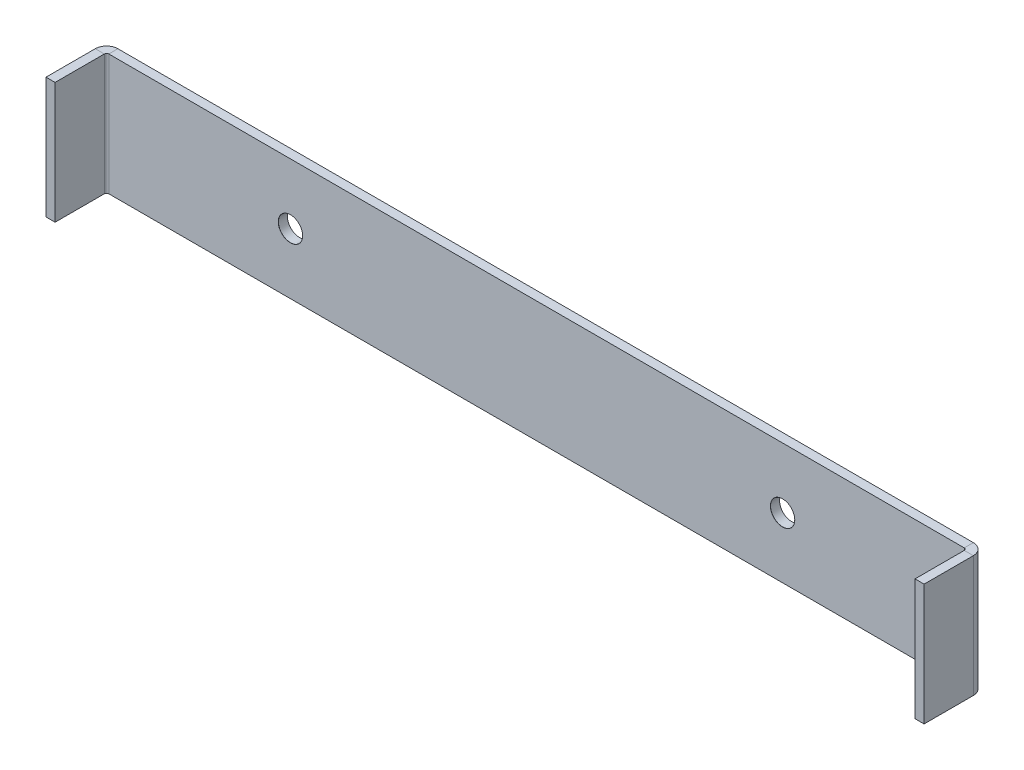
from build123d import *

# Parameters (mm, degrees)
SKETCH1_W                      = 290
SKETCH1_H                      = 40
BASE_FLANGE1_DEPTH             = 3
EDGE_FLANGE1_STRIP_W           = 13.4732
EDGE_FLANGE1_STRIP_H           = 3
EDGE_FLANGE1_STRIP_CUT_DEPTH   = 40
EDGE_FLANGE1_DEPTH             = 40
EDGE_FLANGE2_STRIP_W           = 13.4732
EDGE_FLANGE2_STRIP_H           = 3
EDGE_FLANGE2_STRIP_CUT_DEPTH   = 40
EDGE_FLANGE2_DEPTH             = 40
F_8_0MM_DOWEL_HOLE1_AT_2_COUNT = 2
F_8_0MM_DOWEL_HOLE1_AT_2_PITCH = 162.5268


# Sheet-metal steps are written as plain solids
with BuildPart() as part:
    # Sketch1 → Base-Flange1 (new body)
    with BuildSketch(Plane.XY):
        with Locations((145, 20)):
            Rectangle(SKETCH1_W, SKETCH1_H)
    extrude(amount=-BASE_FLANGE1_DEPTH)

    # Edge-Flange1 strip (across the edge) → Edge-Flange1 strip cut (cut)
    with BuildSketch(Plane.XZ.offset(-40)):
        with Locations((-3, -1.5)):
            Rectangle(EDGE_FLANGE1_STRIP_W, EDGE_FLANGE1_STRIP_H)
    extrude(amount=EDGE_FLANGE1_STRIP_CUT_DEPTH, mode=Mode.SUBTRACT)

    # Edge-Flange1 section (across the edge) → Edge-Flange1 (add)
    with BuildSketch(Plane.XZ.offset(-40)):
        with BuildLine():
            Line((0, 0.7366), (0, 17))
            Line((0, 17), (3, 17))
            Line((3, 17), (3, 0.7366))
            ThreePointArc((3, 0.7366), (3.215745145, 0.215745145), (3.7366, 0))
            Line((3.7366, 0), (3.7366, -3))
            ThreePointArc((3.7366, -3), (1.094424801, -1.905575199), (0, 0.7366))
        make_face()
    extrude(amount=EDGE_FLANGE1_DEPTH)

    # Edge-Flange2 strip (across the edge) → Edge-Flange2 strip cut (cut)
    with BuildSketch(Plane(origin=(290, 0, 0), x_dir=(-1, 0, 0), z_dir=(0, 1, 0))):
        with Locations((-3, -1.5)):
            Rectangle(EDGE_FLANGE2_STRIP_W, EDGE_FLANGE2_STRIP_H)
    extrude(amount=EDGE_FLANGE2_STRIP_CUT_DEPTH, mode=Mode.SUBTRACT)

    # Edge-Flange2 section (across the edge) → Edge-Flange2 (add)
    with BuildSketch(Plane(origin=(290, 0, 0), x_dir=(-1, 0, 0), z_dir=(0, 1, 0))):
        with BuildLine():
            Line((0, 0.7366), (0, 17))
            Line((0, 17), (3, 17))
            Line((3, 17), (3, 0.7366))
            ThreePointArc((3, 0.7366), (3.215745145, 0.215745145), (3.7366, 0))
            Line((3.7366, 0), (3.7366, -3))
            ThreePointArc((3.7366, -3), (1.094424801, -1.905575199), (0, 0.7366))
        make_face()
    extrude(amount=EDGE_FLANGE2_DEPTH)

    # Sketch13 → Ø8.0mm Dowel Hole1 (revolve, cut)
    with BuildSketch(Plane(origin=(226.2634, 20, 0), x_dir=(0, -1, 0), z_dir=(1, 0, 0))):
        Polygon((0, 0), (0, 3), (4, 3), (4, 0.025), (4.025, 0), align=None)
    f_8_0mm_dowel_hole1 = revolve(axis=Axis((226.2634, 20, 6.35), (0, 0, -1)), mode=Mode.SUBTRACT)

    # Ø8.0mm Dowel Hole1 at 2: Ø8.0mm Dowel Hole1 ×2
    with Locations(*[(-i * F_8_0MM_DOWEL_HOLE1_AT_2_PITCH, 0, 0) for i in range(1, F_8_0MM_DOWEL_HOLE1_AT_2_COUNT)]):
        add(f_8_0mm_dowel_hole1, mode=Mode.SUBTRACT)


solid = part.part
